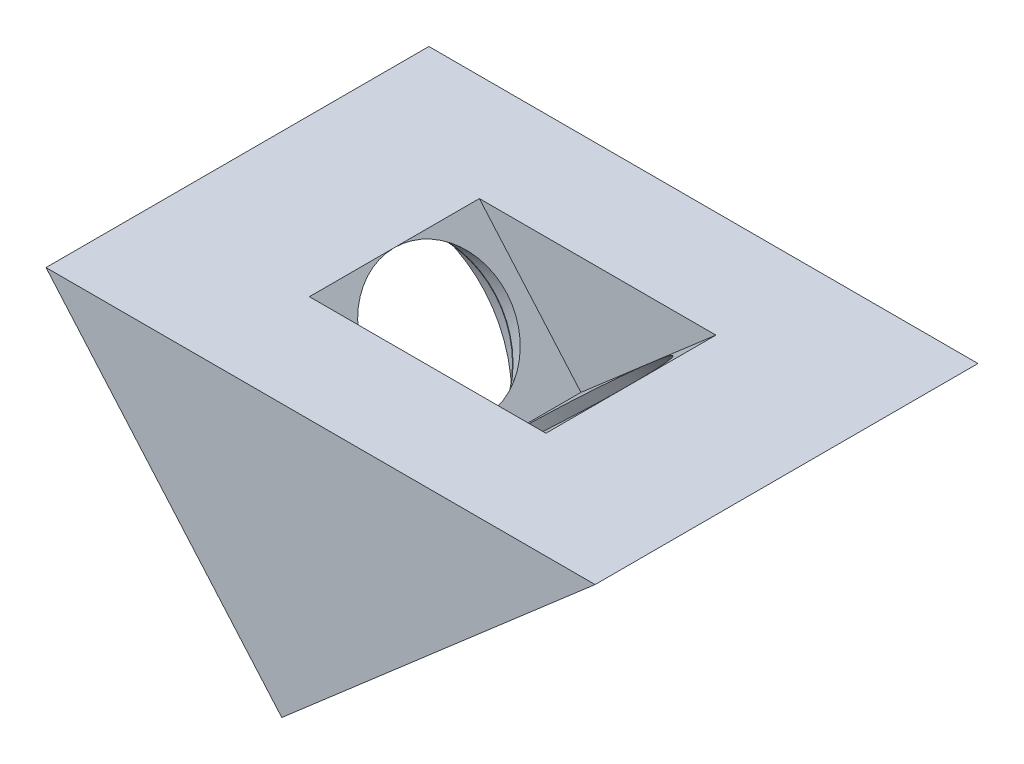
from build123d import *

# Parameters (mm, degrees)
BOSS_EXTRUDE1_START = -7.151569
BOSS_EXTRUDE1_DEPTH = 14.303137569
CAVITY3_START       = -3.125287666
CAVITY3_DEPTH       = 9.3420001
CAVITY3_START_2     = -7.554089613
CAVITY3_2_OUTLINE_R = 3.278779553
CAVITY3_2_DEPTH     = 2.904801847
CAVITY3_START_3     = 0.374712334
CAVITY3_3_DEPTH     = 2.960969152
CAVITY3_START_4     = -3.175
CAVITY3_4_DEPTH     = 6.35


with BuildPart() as part:
    # Sketch1 → Boss-Extrude1 (new body)
    with BuildSketch(Plane.XY.offset(BOSS_EXTRUDE1_START)):
        Polygon((-10, 0), (10.513602901, 0), (-1.192334822, -10.153914519), align=None)
    extrude(amount=BOSS_EXTRUDE1_DEPTH)

    # Cavity3: read off the stored shape, not the designer's step
    # Cavity3 outline → Cavity3 (cut)
    with BuildSketch(Plane(origin=(0, 0, 0), x_dir=(0.6552536158947596, -0.7554089613294528, 0), z_dir=(0.7554089613294528, 0.6552536158947598, 0)).offset(CAVITY3_START)):
        with BuildLine():
            Line((3.079076317, -3.175), (3.079076317, 3.175))
            Line((3.079076317, 3.175), (-0.989318671, 3.175))
            ThreePointArc((-0.989318671, 3.175), (-3.449703236, 0), (-0.989318671, -3.175))
            Line((-0.989318671, -3.175), (3.079076317, -3.175))
        make_face()
    extrude(amount=CAVITY3_DEPTH, mode=Mode.SUBTRACT)

    # Cavity3 2 outline → Cavity3 2 (cut)
    with BuildSketch(Plane(origin=(0, 0, 0), x_dir=(0.6552536158947596, -0.7554089613294528, 0), z_dir=(0.7554089613294528, 0.6552536158947598, 0)).offset(CAVITY3_START_2)):
        with Locations((-0.170923683, 0)):
            Circle(CAVITY3_2_OUTLINE_R)
    extrude(amount=CAVITY3_2_DEPTH, mode=Mode.SUBTRACT)

    # Cavity3 3 outline → Cavity3 3 (cut)
    with BuildSketch(Plane(origin=(0, 0, 0), x_dir=(0.6552536158947596, -0.7554089613294528, 0), z_dir=(0.7554089613294528, 0.6552536158947598, 0)).offset(CAVITY3_START_3)):
        with BuildLine():
            Line((3.079076317, 0.433468981), (3.079076317, -0.433468981))
            ThreePointArc((3.079076317, -0.433468981), (3.10785587, 0), (3.079076317, 0.433468981))
        make_face()
    extrude(amount=CAVITY3_3_DEPTH, mode=Mode.SUBTRACT)

    # Cavity3 4 outline → Cavity3 4 (cut)
    with BuildSketch(Plane.XY.offset(CAVITY3_START_4)):
        Polygon((-0.343294419, -4.373817886), (4.699060398, 0), (-4.137212856, 0), align=None)
    extrude(amount=CAVITY3_4_DEPTH, mode=Mode.SUBTRACT)

    # Cavity3 5: loft between two sections, ruled curve by curve
    cavity3_5_from = [
        Edge.make_three_point_arc((2.300636945, -2.08043023, -3.175), (4.699060398, 0, 0), (2.300636945, -2.08043023, 3.175)),
        Edge.make_three_point_arc((2.300636945, -2.08043023, 3.175), (-0.097786507, -4.160860461, 0), (2.300636945, -2.08043023, -3.175)),
    ]
    cavity3_5_to = [
        Edge.make_three_point_arc((4.797153222, -4.958538373, -5.842), (9.210252374, -1.130546749, 0), (4.797153222, -4.958538373, 5.842)),
        Edge.make_three_point_arc((4.797153222, -4.958538373, 5.842), (0.38405407, -8.786529997, 0), (4.797153222, -4.958538373, -5.842)),
    ]
    cavity3_5 = Solid(Shell([*[Face.make_surface_from_curves(cavity3_5_from[k], cavity3_5_to[k]) for k in range(2)], Face(Wire(cavity3_5_from)), Face(Wire(cavity3_5_to))]))
    add(cavity3_5, mode=Mode.SUBTRACT)

    # Cavity3 6: loft between two sections, ruled curve by curve
    cavity3_6_from = [
        Edge.make_three_point_arc((-3.643299316, -2.933988714, -3.304179553), (-1.478223716, -5.429995558, 0), (-3.643299316, -2.933988714, 3.304179553)),
        Edge.make_three_point_arc((-3.643299316, -2.933988714, 3.304179553), (-5.808374915, -0.43798187, 0), (-3.643299316, -2.933988714, -3.304179553)),
    ]
    cavity3_6_to = [
        Edge.make_three_point_arc((-5.81842535, -4.820727252, -5.075783124), (-2.492500105, -8.655019309, 0), (-5.81842535, -4.820727252, 5.075783124)),
        Edge.make_three_point_arc((-5.81842535, -4.820727252, 5.075783124), (-9.144350595, -0.986435194, 0), (-5.81842535, -4.820727252, -5.075783124)),
    ]
    cavity3_6 = Solid(Shell([*[Face.make_surface_from_curves(cavity3_6_from[k], cavity3_6_to[k]) for k in range(2)], Face(Wire(cavity3_6_from)), Face(Wire(cavity3_6_to))]))
    add(cavity3_6, mode=Mode.SUBTRACT)

    # Cavity3 7: loft between two sections, ruled curve by curve
    cavity3_7_from = [
        Edge.make_three_point_arc((-2.472868671, -1.918738762, -2.54), (-0.808524487, -3.837477524, 0), (-2.472868671, -1.918738762, 2.54)),
        Edge.make_three_point_arc((-2.472868671, -1.918738762, 2.54), (-4.137212855, 0, 0), (-2.472868671, -1.918738762, -2.54)),
    ]
    cavity3_7_to = [
        Edge.make_three_point_arc((-3.624111928, -2.917345272, -3.278779553), (-1.47567977, -5.394164729, 0), (-3.624111928, -2.917345272, 3.278779553)),
        Edge.make_three_point_arc((-3.624111928, -2.917345272, 3.278779553), (-5.772544086, -0.440525816, 0), (-3.624111928, -2.917345272, -3.278779553)),
    ]
    cavity3_7 = Solid(Shell([*[Face.make_surface_from_curves(cavity3_7_from[k], cavity3_7_to[k]) for k in range(2)], Face(Wire(cavity3_7_from)), Face(Wire(cavity3_7_to))]))
    add(cavity3_7, mode=Mode.SUBTRACT)


solid = part.part
